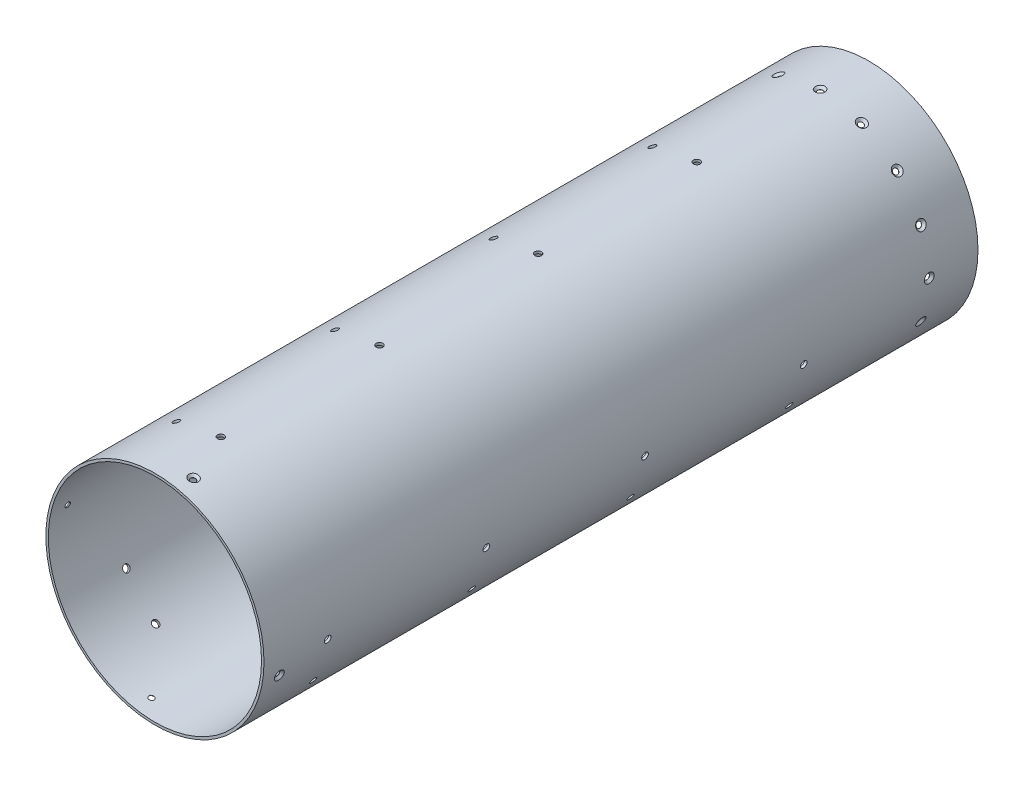
from build123d import *

# Parameters (mm, degrees)
SKETCH1_R                                       = 69.85
SKETCH1_R_2                                     = 68.2625
EXTRUDE1_DEPTH                                  = 457.2
CSK_FOR_M3_FLAT_HEAD_MACHINE_SCREW1_D           = 3.4
CSK_FOR_M3_FLAT_HEAD_MACHINE_SCREW1_CSINK_D     = 6.3
CSK_FOR_M3_FLAT_HEAD_MACHINE_SCREW1_CSINK_ANGLE = 90
CIRPATTERN1_COUNT                               = 16
F_10_CLEARANCE_HOLE1_D                          = 5.1054
F_10_CLEARANCE_HOLE1_DEPTH                      = 12.7
F_10_CLEARANCE_HOLE1_TIP                        = 1.533816902
CIRPATTERN2_COUNT                               = 4
CIRPATTERN3_COUNT                               = 3
LPATTERN1_COUNT                                 = 4
LPATTERN1_PITCH                                 = 101.6


with BuildPart() as part:
    # Sketch1 → Extrude1 (new body)
    with BuildSketch(Plane.XY):
        Circle(SKETCH1_R)
        Circle(SKETCH1_R_2, mode=Mode.SUBTRACT)
    extrude(amount=EXTRUDE1_DEPTH)

    # CSK for M3 Flat Head Machine Screw1 (through all)
    with Locations(Plane(origin=(0, -69.85, 31.242), x_dir=(1, 0, 0), z_dir=(0, -1, 0))):
        with Locations((0, 0)):
            csk_for_m3_flat_head_machine_screw1 = CounterSinkHole(CSK_FOR_M3_FLAT_HEAD_MACHINE_SCREW1_D / 2, CSK_FOR_M3_FLAT_HEAD_MACHINE_SCREW1_CSINK_D / 2, counter_sink_angle=CSK_FOR_M3_FLAT_HEAD_MACHINE_SCREW1_CSINK_ANGLE)

    # CirPattern1: CSK for M3 Flat Head Machine Screw1 ×16 about axis
    cirpattern1_axis = Axis((0, 0, 457.2), (0, 0, -1))
    for i in range(1, CIRPATTERN1_COUNT):
        add(csk_for_m3_flat_head_machine_screw1.rotate(cirpattern1_axis, i * 360 / CIRPATTERN1_COUNT), mode=Mode.SUBTRACT)

    # #10 Clearance Hole1
    with Locations(Plane(origin=(13.627058993, -68.507851836, 31.242), x_dir=(0.9807852804032304, 0.19509032201612855, 0), z_dir=(0.19509032201612853, -0.9807852804032303, 0))):
        with Locations((0, 0)):
            Hole(F_10_CLEARANCE_HOLE1_D / 2, depth=F_10_CLEARANCE_HOLE1_DEPTH)
            with Locations((0, 0, -(F_10_CLEARANCE_HOLE1_DEPTH + F_10_CLEARANCE_HOLE1_TIP / 2))):  # 118° drill point
                Cone(0, F_10_CLEARANCE_HOLE1_D / 2, F_10_CLEARANCE_HOLE1_TIP, mode=Mode.SUBTRACT)

    # Sketch16 → CSK for M3 Flat Head Machine Screw2 (revolve, cut)
    with BuildSketch(Plane(origin=(13.627058993, 68.507851836, 446.0748), x_dir=(-0.9807852804032304, 0.19509032201612872, 0), z_dir=(0, 0, 1))):
        Polygon((0, 0), (0, 8.641463052), (1.7, 7.62), (1.7, 1.45), (3.15, 0), align=None)
    csk_for_m3_flat_head_machine_screw2 = revolve(axis=Axis((14.865882538, 74.735838367, 446.0748), (-0.19509032201612872, -0.9807852804032304, 0)), mode=Mode.SUBTRACT)

    # CirPattern2: CSK for M3 Flat Head Machine Screw2 ×4 about axis
    cirpattern2_axis = Axis((0, 0, 457.2), (0, 0, -1))
    for i in range(1, CIRPATTERN2_COUNT):
        add(csk_for_m3_flat_head_machine_screw2.rotate(cirpattern2_axis, i * 360 / CIRPATTERN2_COUNT), mode=Mode.SUBTRACT)

    # Sketch22 → #6 Clearance Hole1 (revolve, cut)
    with BuildSketch(Plane(origin=(0.914308251, 69.844015781, 415.925), x_dir=(-0.9999143275740071, 0.013089595571344799, 0), z_dir=(0, 0, 1))):
        Polygon((0, 0), (0, 13.993442612), (2.15265, 12.7), (2.15265, 0), align=None)
    f_6_clearance_hole1 = revolve(axis=Axis((0.997427183, 76.193471761, 415.925), (-0.013089595571344799, -0.999914327574007, 0)), mode=Mode.SUBTRACT)

    # Sketch24 → #6 Clearance Hole2 (revolve, cut)
    with BuildSketch(Plane(origin=(-27.572858368, 64.177566029, 415.925), x_dir=(-0.918791210148898, -0.3947438563842681, 0), z_dir=(0, 0, 1))):
        Polygon((0, 0), (0, 13.993442612), (2.15265, 12.7), (2.15265, 0), align=None)
    f_6_clearance_hole2 = revolve(axis=Axis((-30.079481856, 70.011890213, 415.925), (0.3947438563842681, -0.918791210148898, 0)), mode=Mode.SUBTRACT)

    # CirPattern3: #6 Clearance Hole1, #6 Clearance Hole2 ×3 about axis
    cirpattern3_axis = Axis((0, 0, 457.2), (0, 0, -1))
    add([f_6_clearance_hole1.rotate(cirpattern3_axis, i * 360 / CIRPATTERN3_COUNT) for i in range(1, CIRPATTERN3_COUNT)], mode=Mode.SUBTRACT)
    add([f_6_clearance_hole2.rotate(cirpattern3_axis, i * 360 / CIRPATTERN3_COUNT) for i in range(1, CIRPATTERN3_COUNT)], mode=Mode.SUBTRACT)

    # LPattern1: #6 Clearance Hole1, #6 Clearance Hole2 ×4
    with Locations(*[(0, 0, -i * LPATTERN1_PITCH) for i in range(1, LPATTERN1_COUNT)]):
        add(f_6_clearance_hole1, mode=Mode.SUBTRACT)
        add(f_6_clearance_hole2, mode=Mode.SUBTRACT)

    # LPattern1 copy 1 sketch → LPattern1 copy 1 (revolve, cut)
    with BuildSketch(Plane(origin=(60.029537843, -35.713822062, 314.325), x_dir=(0.5112930860770523, 0.8594064115014526, 0), z_dir=(0, 0, 1))):
        Polygon((0, 0), (0, 13.993442612), (2.15265, 12.7), (2.15265, 0), align=None)
    revolve(axis=Axis((65.486768556, -38.960533159, 314.325), (-0.8594064115014525, 0.5112930860770522, 0)), mode=Mode.SUBTRACT)

    # LPattern1 copy 2 sketch → LPattern1 copy 2 (revolve, cut)
    with BuildSketch(Plane(origin=(60.029537843, -35.713822062, 212.725), x_dir=(0.5112930860770523, 0.8594064115014526, 0), z_dir=(0, 0, 1))):
        Polygon((0, 0), (0, 13.993442612), (2.15265, 12.7), (2.15265, 0), align=None)
    revolve(axis=Axis((65.486768556, -38.960533159, 212.725), (-0.8594064115014525, 0.5112930860770522, 0)), mode=Mode.SUBTRACT)

    # LPattern1 copy 3 sketch → LPattern1 copy 3 (revolve, cut)
    with BuildSketch(Plane(origin=(60.029537843, -35.713822062, 111.125), x_dir=(0.5112930860770523, 0.8594064115014526, 0), z_dir=(0, 0, 1))):
        Polygon((0, 0), (0, 13.993442612), (2.15265, 12.7), (2.15265, 0), align=None)
    revolve(axis=Axis((65.486768556, -38.960533159, 111.125), (-0.8594064115014525, 0.5112930860770522, 0)), mode=Mode.SUBTRACT)

    # LPattern1 copy 4 sketch → LPattern1 copy 4 (revolve, cut)
    with BuildSketch(Plane(origin=(-60.943846094, -34.130193719, 314.325), x_dir=(0.4886212414969551, -0.8724960070727971, 0), z_dir=(0, 0, 1))):
        Polygon((0, 0), (0, 13.993442612), (2.15265, 12.7), (2.15265, 0), align=None)
    revolve(axis=Axis((-66.484195739, -37.232938602, 314.325), (0.872496007072797, 0.48862124149695507, 0)), mode=Mode.SUBTRACT)

    # LPattern1 copy 5 sketch → LPattern1 copy 5 (revolve, cut)
    with BuildSketch(Plane(origin=(-60.943846094, -34.130193719, 212.725), x_dir=(0.4886212414969551, -0.8724960070727971, 0), z_dir=(0, 0, 1))):
        Polygon((0, 0), (0, 13.993442612), (2.15265, 12.7), (2.15265, 0), align=None)
    revolve(axis=Axis((-66.484195739, -37.232938602, 212.725), (0.872496007072797, 0.48862124149695507, 0)), mode=Mode.SUBTRACT)

    # LPattern1 copy 6 sketch → LPattern1 copy 6 (revolve, cut)
    with BuildSketch(Plane(origin=(-60.943846094, -34.130193719, 111.125), x_dir=(0.4886212414969551, -0.8724960070727971, 0), z_dir=(0, 0, 1))):
        Polygon((0, 0), (0, 13.993442612), (2.15265, 12.7), (2.15265, 0), align=None)
    revolve(axis=Axis((-66.484195739, -37.232938602, 111.125), (0.872496007072797, 0.48862124149695507, 0)), mode=Mode.SUBTRACT)

    # LPattern1 copy 7 sketch → LPattern1 copy 7 (revolve, cut)
    with BuildSketch(Plane(origin=(69.365831718, -8.209987212, 314.325), x_dir=(0.11753739745783648, 0.9930684569549264, 0), z_dir=(0, 0, 1))):
        Polygon((0, 0), (0, 13.993442612), (2.15265, 12.7), (2.15265, 0), align=None)
    revolve(axis=Axis((75.67181642, -8.956349686, 314.325), (-0.9930684569549264, 0.11753739745783648, 0)), mode=Mode.SUBTRACT)

    # LPattern1 copy 8 sketch → LPattern1 copy 8 (revolve, cut)
    with BuildSketch(Plane(origin=(69.365831718, -8.209987212, 212.725), x_dir=(0.11753739745783648, 0.9930684569549264, 0), z_dir=(0, 0, 1))):
        Polygon((0, 0), (0, 13.993442612), (2.15265, 12.7), (2.15265, 0), align=None)
    revolve(axis=Axis((75.67181642, -8.956349686, 212.725), (-0.9930684569549264, 0.11753739745783648, 0)), mode=Mode.SUBTRACT)

    # LPattern1 copy 9 sketch → LPattern1 copy 9 (revolve, cut)
    with BuildSketch(Plane(origin=(69.365831718, -8.209987212, 111.125), x_dir=(0.11753739745783648, 0.9930684569549264, 0), z_dir=(0, 0, 1))):
        Polygon((0, 0), (0, 13.993442612), (2.15265, 12.7), (2.15265, 0), align=None)
    revolve(axis=Axis((75.67181642, -8.956349686, 111.125), (-0.9930684569549264, 0.11753739745783648, 0)), mode=Mode.SUBTRACT)

    # LPattern1 copy 10 sketch → LPattern1 copy 10 (revolve, cut)
    with BuildSketch(Plane(origin=(-41.79297335, -55.967578816, 314.325), x_dir=(0.8012538126910616, -0.598324600570658, 0), z_dir=(0, 0, 1))):
        Polygon((0, 0), (0, 13.993442612), (2.15265, 12.7), (2.15265, 0), align=None)
    revolve(axis=Axis((-45.592334563, -61.055540527, 314.325), (0.598324600570658, 0.8012538126910616, 0)), mode=Mode.SUBTRACT)

    # LPattern1 copy 11 sketch → LPattern1 copy 11 (revolve, cut)
    with BuildSketch(Plane(origin=(-41.79297335, -55.967578816, 212.725), x_dir=(0.8012538126910616, -0.598324600570658, 0), z_dir=(0, 0, 1))):
        Polygon((0, 0), (0, 13.993442612), (2.15265, 12.7), (2.15265, 0), align=None)
    revolve(axis=Axis((-45.592334563, -61.055540527, 212.725), (0.598324600570658, 0.8012538126910616, 0)), mode=Mode.SUBTRACT)

    # LPattern1 copy 12 sketch → LPattern1 copy 12 (revolve, cut)
    with BuildSketch(Plane(origin=(-41.79297335, -55.967578816, 111.125), x_dir=(0.8012538126910616, -0.598324600570658, 0), z_dir=(0, 0, 1))):
        Polygon((0, 0), (0, 13.993442612), (2.15265, 12.7), (2.15265, 0), align=None)
    revolve(axis=Axis((-45.592334563, -61.055540527, 111.125), (0.598324600570658, 0.8012538126910616, 0)), mode=Mode.SUBTRACT)


solid = part.part
